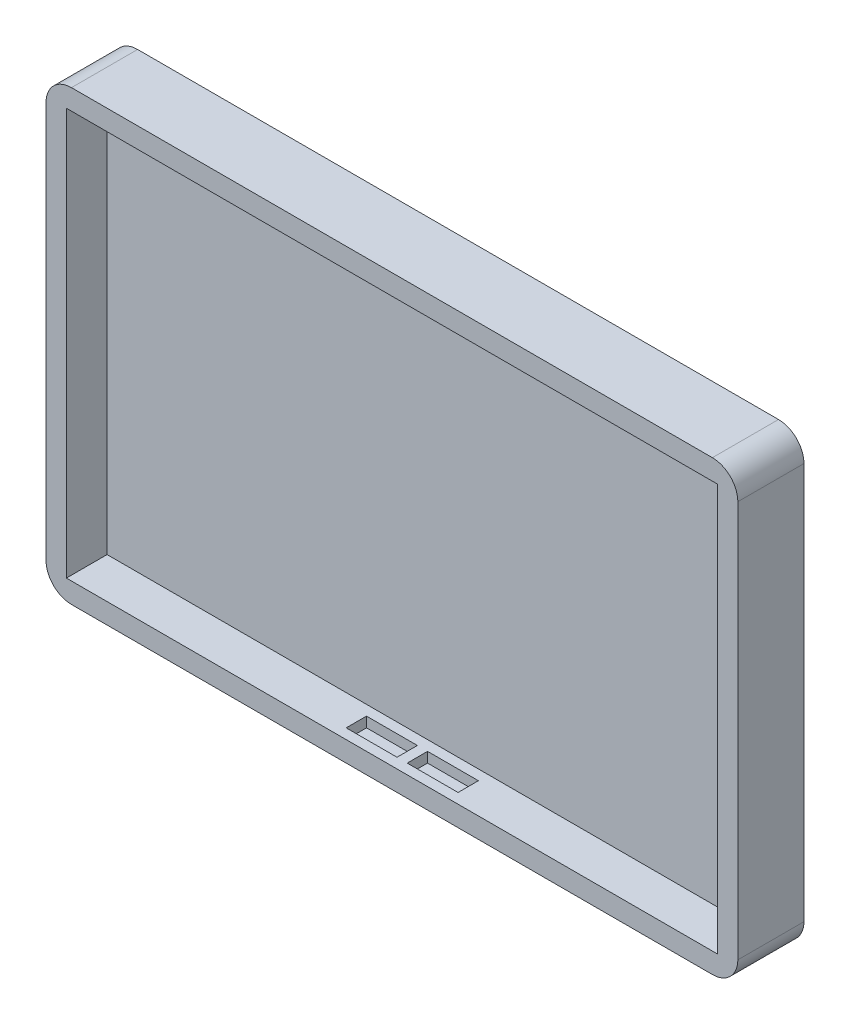
from build123d import *

# Parameters (mm, degrees)
SKETCH1_W               = 68
SKETCH1_H               = 44
BOSS_EXTRUDE1_DEPTH     = 6.5
SKETCH2_W               = 64
SKETCH2_H               = 40
CUT_EXTRUDE1_DEPTH      = 4
CUT_EXTRUDE2_DEPTH      = 41
CUT_EXTRUDE2_DEPTH_BACK = 1
SKETCH4_W               = 5
SKETCH4_H               = 2
FILLET8_R               = 2.5


with BuildPart() as part:
    # Sketch1 → Boss-Extrude1 (new body)
    with BuildSketch(Plane.XY):
        with Locations((34, 22)):
            Rectangle(SKETCH1_W, SKETCH1_H)
    extrude(amount=BOSS_EXTRUDE1_DEPTH)

    # Sketch2 → Cut-Extrude1 (cut)
    with BuildSketch(Plane.XY.offset(6.5)):
        with Locations((34, 22)):
            Rectangle(SKETCH2_W, SKETCH2_H)
    extrude(amount=-CUT_EXTRUDE1_DEPTH, mode=Mode.SUBTRACT)

    # Sketch4 → Cut-Extrude2 (cut, two sides: drawn at the far end of the back side and taken through both)
    with BuildSketch(Plane.XZ.offset(-42).offset(-CUT_EXTRUDE2_DEPTH_BACK)):
        with Locations((31, 4.5)):
            Rectangle(SKETCH4_W, SKETCH4_H)
        with Locations((37, 4.5)):
            Rectangle(SKETCH4_W, SKETCH4_H)
    extrude(amount=CUT_EXTRUDE2_DEPTH + CUT_EXTRUDE2_DEPTH_BACK, mode=Mode.SUBTRACT)

    # Fillet8
    fillet8_edges = [part.edges().sort_by_distance(p)[0] for p in [
        (0, 44, 3.25),
        (0, 0, 3.25),
        (68, 0, 3.25),
        (68, 44, 3.25),
    ]]
    fillet(fillet8_edges, radius=FILLET8_R)


solid = part.part
